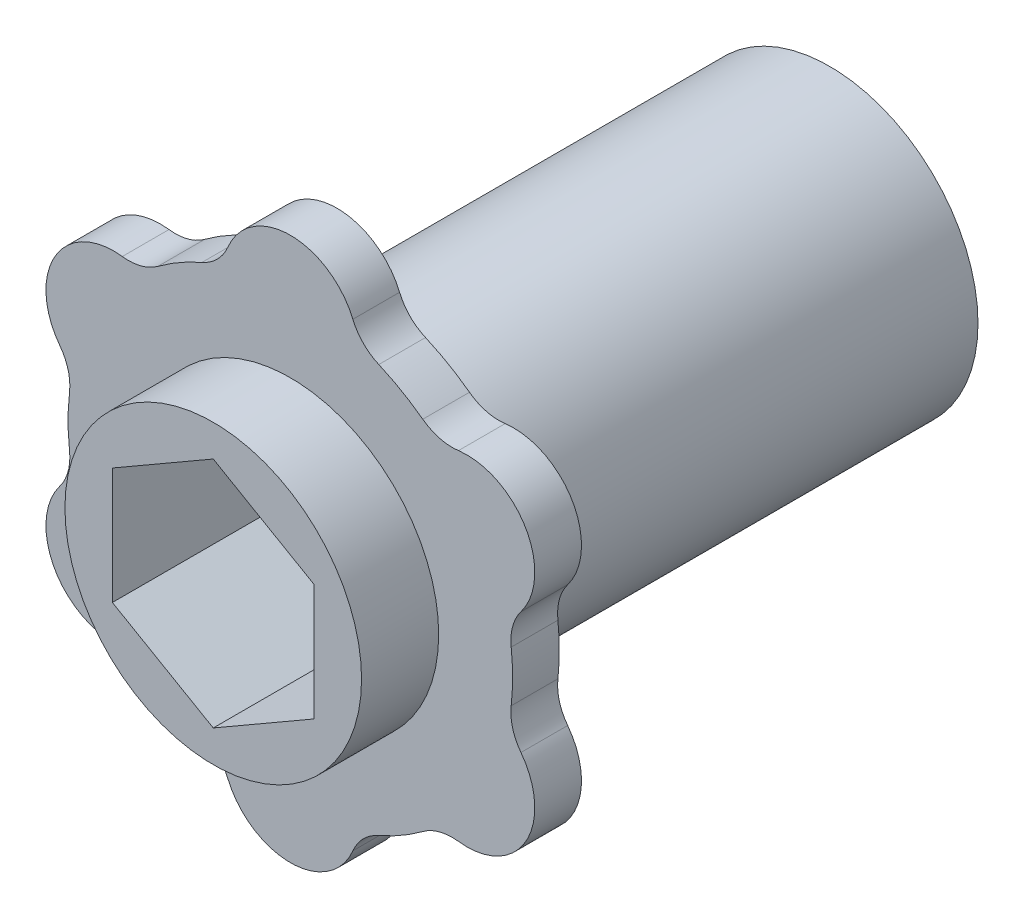
from build123d import *

# Parameters (mm, degrees)
BOSS_EXTRUDE1_DEPTH = 1.49987
SKETCH2_R           = 9.525
BOSS_EXTRUDE2_DEPTH = 4.953
BOSS_EXTRUDE3_START = 31.63316
SKETCH3_R           = 9.525
BOSS_EXTRUDE3_DEPTH = 31.63316
FILLET1_R           = 3.175


with BuildPart() as part:
    # Sketch1 → Boss-Extrude1 (new, symmetric)
    with BuildSketch(Plane.XY):
        with BuildLine():
            ThreePointArc((-13.943369395, 3.058163658), (-14.2748, 0), (-13.943369395, -3.058163658))
            ThreePointArc((-13.943369395, -3.058163658), (-15.111970091, -8.7249), (-9.620132114, -10.546230281))
            ThreePointArc((-9.620132114, -10.546230281), (-7.1374, -12.362339434), (-4.32323728, -13.604393939))
            ThreePointArc((-4.32323728, -13.604393939), (0, -17.4498), (4.32323728, -13.604393939))
            ThreePointArc((4.32323728, -13.604393939), (7.1374, -12.362339434), (9.620132114, -10.546230281))
            ThreePointArc((9.620132114, -10.546230281), (15.111970091, -8.7249), (13.943369395, -3.058163658))
            ThreePointArc((13.943369395, -3.058163658), (14.2748, 0), (13.943369395, 3.058163658))
            ThreePointArc((13.943369395, 3.058163658), (15.111970091, 8.7249), (9.620132114, 10.546230281))
            ThreePointArc((9.620132114, 10.546230281), (7.1374, 12.362339434), (4.32323728, 13.604393939))
            ThreePointArc((4.32323728, 13.604393939), (0, 17.4498), (-4.32323728, 13.604393939))
            ThreePointArc((-4.32323728, 13.604393939), (-7.1374, 12.362339434), (-9.620132114, 10.546230281))
            ThreePointArc((-9.620132114, 10.546230281), (-15.111970091, 8.7249), (-13.943369395, 3.058163658))
        make_face()
        Polygon((0, 7.478995387), (-6.477, 3.739497694), (-6.477, -3.739497694), (0, -7.478995387), (6.477, -3.739497694), (6.477, 3.739497694), align=None, mode=Mode.SUBTRACT)
    extrude(amount=BOSS_EXTRUDE1_DEPTH, both=True)

    # Sketch2 → Boss-Extrude2 (add)
    with BuildSketch(Plane.XY.offset(1.49987)):
        Circle(SKETCH2_R)
        Polygon((0, 7.478995387), (-6.477, 3.739497694), (-6.477, -3.739497694), (0, -7.478995387), (6.477, -3.739497694), (6.477, 3.739497694), align=None, mode=Mode.SUBTRACT)
    extrude(amount=BOSS_EXTRUDE2_DEPTH)

    # Sketch3 → Boss-Extrude3 (add)
    with BuildSketch(Plane(origin=(0, 0, -1.49987), x_dir=(-1, 0, 0), z_dir=(0, 0, -1)).offset(BOSS_EXTRUDE3_START)):
        Circle(SKETCH3_R)
        Polygon((0, 7.478995387), (-6.477, 3.739497694), (-6.477, -3.739497694), (0, -7.478995387), (6.477, -3.739497694), (6.477, 3.739497694), align=None, mode=Mode.SUBTRACT)
    extrude(amount=-BOSS_EXTRUDE3_DEPTH)

    # Fillet1
    fillet1_edges = [part.edges().sort_by_distance(p)[0] for p in [
        (9.620132114, 10.546230281, 0),
        (13.943369395, 3.058163658, 0),
        (13.943369395, -3.058163658, 0),
        (9.620132114, -10.546230281, 0),
        (4.32323728, -13.604393939, 0),
        (-4.32323728, -13.604393939, 0),
        (-9.620132114, -10.546230281, 0),
        (-13.943369395, -3.058163658, 0),
        (-13.943369395, 3.058163658, 0),
        (-9.620132114, 10.546230281, 0),
        (-4.32323728, 13.604393939, 0),
        (4.32323728, 13.604393939, 0),
    ]]
    fillet(fillet1_edges, radius=FILLET1_R)


solid = part.part
